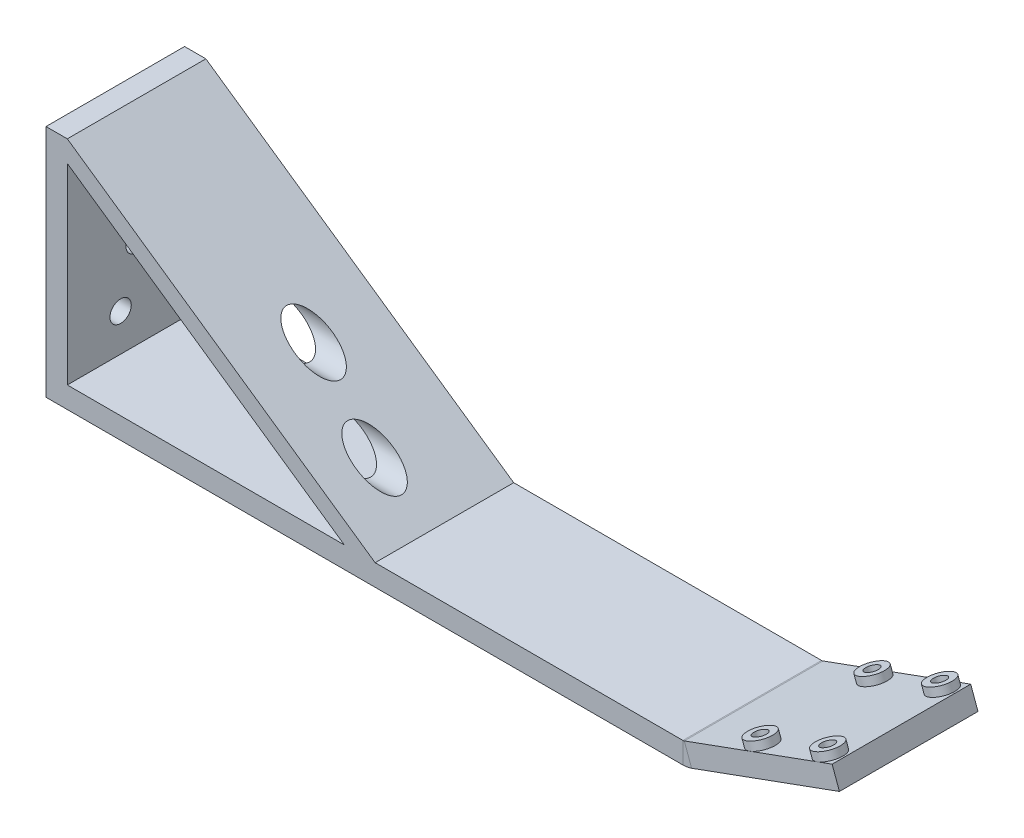
from build123d import *

# Parameters (mm, degrees)
ESQUISSE2_W                 = 150
ESQUISSE2_H                 = 26
T_LE_DE_BASE_PLI_E1_DEPTH   = 4
PLI_START                   = -13
PLI_ESQUISS_1_DEPTH         = 26
PLI_ESQUISS_1_2_DEPTH       = 26
ESQUISSE9_R                 = 2.5
ESQUISSE9_R_2               = 1.25
BOSS_EXTRU_1_DEPTH          = 1.5
ENL_V_START                 = -4
ENL_V_MAT_EXTRU_1_OUTLINE_R = 1.25
ENL_V_MAT_EXTRU_1_DEPTH     = 4
ESQUISSE11_W                = 4
ESQUISSE11_H                = 26
BOSS_EXTRU_2_DEPTH          = 40
BOSS_EXTRU_3_DEPTH          = 4
ESQUISSE12_R                = 2
ENL_V_MAT_EXTRU_5_DEPTH     = 151.86574353
ENL_V_MAT_EXTRU_6_REACH     = 152.866
ESQUISSE12_4_R              = 3.5
ESQUISSE12_4_R_2            = 2


# Read off the part's stored shape, not the designer's step: Pli esquissé1, Enlèv. mat.-Extru.1
# Sheet-metal steps are written as plain solids
with BuildPart() as part:
    # Esquisse2 → Tôle de base pliée1 (new body)
    with BuildSketch(Plane(origin=(0, 0, 0), x_dir=(1, 0, 0), z_dir=(0, 1, 0))):
        Rectangle(ESQUISSE2_W, ESQUISSE2_H)
    extrude(amount=-T_LE_DE_BASE_PLI_E1_DEPTH)

    # Pli esquissé1 outline → Pli esquissé1 (cut)
    with BuildSketch(Plane.XY.offset(PLI_START)):
        with BuildLine():
            Line((75, 0), (56.347473252, 0))
            Line((56.347473252, 0), (46.142385808, -3.714348068))
            ThreePointArc((46.142385808, -3.714348068), (45.344875155, -3.928040403), (44.522373197, -4))
            Line((44.522373197, -4), (75, -4))
            Line((75, -4), (75, 0))
        make_face()
    extrude(amount=PLI_ESQUISS_1_DEPTH, mode=Mode.SUBTRACT)

    # Pli esquiss_1 2 outline → Pli esquiss_1 2 (add)
    with BuildSketch(Plane.XY.offset(PLI_START)):
        with BuildLine():
            Line((56.347473252, 0), (73.884342049, 6.382898245))
            Line((73.884342049, 6.382898245), (72.516261476, 10.141668728))
            Line((72.516261476, 10.141668728), (44.774305234, 0.044422416))
            ThreePointArc((44.774305234, 0.044422416), (44.650282444, 0.011190609), (44.522373197, 0))
            Line((44.522373197, 0), (56.347473252, 0))
        make_face()
    extrude(amount=PLI_ESQUISS_1_2_DEPTH)

    # Esquisse9 → Boss.-Extru.1 (add)
    # profile 1 of 4: a face of its own
    with BuildSketch(Plane(origin=(5.223321668, -14.350958338, 0), x_dir=(0.9396926207859082, 0.34202014332566943, 0), z_dir=(-0.34202014332566943, 0.9396926207859082, 0))):
        with Locations(Location((55.111650787, 10.5, 0), (0, 0, 90))):
            Circle(ESQUISSE9_R)
        with Locations(Location((55.111650787, 10.5, 0), (0, 0, 180))):
            Circle(ESQUISSE9_R_2, mode=Mode.SUBTRACT)
    # profile 2 of 4: a face of its own
    with BuildSketch(Plane(origin=(5.223321668, -14.350958338, 0), x_dir=(0.9396926207859082, 0.34202014332566943, 0), z_dir=(-0.34202014332566943, 0.9396926207859082, 0))):
        with Locations(Location((68.611650787, 10.5, 0), (0, 0, 90))):
            Circle(ESQUISSE9_R)
        with Locations(Location((68.611650787, 10.5, 0), (0, 0, 180))):
            Circle(ESQUISSE9_R_2, mode=Mode.SUBTRACT)
    # profile 3 of 4: a face of its own
    with BuildSketch(Plane(origin=(5.223321668, -14.350958338, 0), x_dir=(0.9396926207859082, 0.34202014332566943, 0), z_dir=(-0.34202014332566943, 0.9396926207859082, 0))):
        with Locations((68.611650787, -10.5)):
            Circle(ESQUISSE9_R)
        with Locations((68.611650787, -10.5)):
            Circle(ESQUISSE9_R_2, mode=Mode.SUBTRACT)
    # profile 4 of 4: a face of its own
    with BuildSketch(Plane(origin=(5.223321668, -14.350958338, 0), x_dir=(0.9396926207859082, 0.34202014332566943, 0), z_dir=(-0.34202014332566943, 0.9396926207859082, 0))):
        with Locations((55.111650787, -10.5)):
            Circle(ESQUISSE9_R)
        with Locations((55.111650787, -10.5)):
            Circle(ESQUISSE9_R_2, mode=Mode.SUBTRACT)
    extrude(amount=BOSS_EXTRU_1_DEPTH)

    # Enlèv. mat.-Extru.1 outline → Enlèv. mat.-Extru.1 (cut)
    with BuildSketch(Plane(origin=(5.223321668, -14.350958338, 0), x_dir=(0.9396926207859082, 0.34202014332566943, 0), z_dir=(-0.34202014332566943, 0.9396926207859082, 0)).offset(ENL_V_START)):
        with Locations((68.611650787, 10.5)):
            Circle(ENL_V_MAT_EXTRU_1_OUTLINE_R)
        with Locations((68.611650787, -10.5)):
            Circle(ENL_V_MAT_EXTRU_1_OUTLINE_R)
        with Locations((55.111650787, 10.5)):
            Circle(ENL_V_MAT_EXTRU_1_OUTLINE_R)
        with Locations((55.111650787, -10.5)):
            Circle(ENL_V_MAT_EXTRU_1_OUTLINE_R)
    extrude(amount=ENL_V_MAT_EXTRU_1_DEPTH, mode=Mode.SUBTRACT)

    # Esquisse11 → Boss.-Extru.2 (add)
    with BuildSketch(Plane(origin=(0, 0, 0), x_dir=(1, 0, 0), z_dir=(0, 1, 0))):
        with Locations((-73, 0)):
            Rectangle(ESQUISSE11_W, ESQUISSE11_H)
    extrude(amount=BOSS_EXTRU_2_DEPTH)

    # Esquisse3D1 → Boss.-Extru.3 (add, along a direction that is not the sketch's normal)
    with BuildSketch(Plane(origin=(-71, 40, -13), x_dir=(0.7710162866859277, -0.533933827949873, 0.34705698816741753), z_dir=(0.5693204883585811, 0.8221156740600114, 0))):
        Polygon((0, 0), (9.023481692, -24.38394509), (74.915650416, 0), (65.892168724, 24.38394509), align=None)
    extrude(amount=-BOSS_EXTRU_3_DEPTH, dir=(0, 1, 0))

    # Esquisse12 → Enlèv. mat.-Extru.5 (cut, through all)
    with BuildSketch(Plane(origin=(-71, 0, 0), x_dir=(0, 0, -1), z_dir=(1, 0, 0))):
        with Locations((-3, 7)):
            Circle(ESQUISSE12_R)
        with Locations((0, 17)):
            Circle(ESQUISSE12_R)
    extrude(amount=-ENL_V_MAT_EXTRU_5_DEPTH, mode=Mode.SUBTRACT)

    # Enlèv. mat.-Extru.6: up to this plane
    enl_v_mat_extru_6_end = Plane(origin=(-4.291041229, -6.196390829, 0), z_dir=(0.5693204883585812, 0.8221156740600113, 0))
    # Esquisse12<4> → Enlèv. mat.-Extru.6 (cut, up to the surface)
    with BuildSketch(Plane(origin=(-71, 0, 0), x_dir=(0, 0, -1), z_dir=(1, 0, 0)), mode=Mode.PRIVATE) as enl_v_mat_extru_6_sk1:
        with Locations(Location((-3, 7, 0), (0, 0, 90))):
            Circle(ESQUISSE12_4_R)
        with Locations((-3, 7)):
            Circle(ESQUISSE12_4_R_2, mode=Mode.SUBTRACT)
    enl_v_mat_extru_6_tool1 = split(extrude(enl_v_mat_extru_6_sk1.sketch, amount=ENL_V_MAT_EXTRU_6_REACH, mode=Mode.PRIVATE), bisect_by=enl_v_mat_extru_6_end, keep=Keep.BOTH, mode=Mode.PRIVATE)
    add(enl_v_mat_extru_6_tool1.solids().sort_by_distance((-71, 3.598995, 3))[0], mode=Mode.SUBTRACT)
    # Esquisse12<4> → Enlèv. mat.-Extru.6 (cut, up to the surface)
    with BuildSketch(Plane(origin=(-71, 0, 0), x_dir=(0, 0, -1), z_dir=(1, 0, 0)), mode=Mode.PRIVATE) as enl_v_mat_extru_6_sk2:
        with Locations((-3, 7)):
            Circle(ESQUISSE12_4_R_2)
    enl_v_mat_extru_6_tool2 = split(extrude(enl_v_mat_extru_6_sk2.sketch, amount=ENL_V_MAT_EXTRU_6_REACH, mode=Mode.PRIVATE), bisect_by=enl_v_mat_extru_6_end, keep=Keep.BOTH, mode=Mode.PRIVATE)
    add(enl_v_mat_extru_6_tool2.solids().sort_by_distance((-71, 7, 3))[0], mode=Mode.SUBTRACT)
    # Esquisse12<4> → Enlèv. mat.-Extru.6 (cut, up to the surface)
    with BuildSketch(Plane(origin=(-71, 0, 0), x_dir=(0, 0, -1), z_dir=(1, 0, 0)), mode=Mode.PRIVATE) as enl_v_mat_extru_6_sk3:
        with Locations(Location((0, 17, 0), (0, 0, 90))):
            Circle(ESQUISSE12_4_R)
        with Locations((0, 17)):
            Circle(ESQUISSE12_4_R_2, mode=Mode.SUBTRACT)
    enl_v_mat_extru_6_tool3 = split(extrude(enl_v_mat_extru_6_sk3.sketch, amount=ENL_V_MAT_EXTRU_6_REACH, mode=Mode.PRIVATE), bisect_by=enl_v_mat_extru_6_end, keep=Keep.BOTH, mode=Mode.PRIVATE)
    add(enl_v_mat_extru_6_tool3.solids().sort_by_distance((-71, 13.598995, 0))[0], mode=Mode.SUBTRACT)
    # Esquisse12<4> → Enlèv. mat.-Extru.6 (cut, up to the surface)
    with BuildSketch(Plane(origin=(-71, 0, 0), x_dir=(0, 0, -1), z_dir=(1, 0, 0)), mode=Mode.PRIVATE) as enl_v_mat_extru_6_sk4:
        with Locations((0, 17)):
            Circle(ESQUISSE12_4_R_2)
    enl_v_mat_extru_6_tool4 = split(extrude(enl_v_mat_extru_6_sk4.sketch, amount=ENL_V_MAT_EXTRU_6_REACH, mode=Mode.PRIVATE), bisect_by=enl_v_mat_extru_6_end, keep=Keep.BOTH, mode=Mode.PRIVATE)
    add(enl_v_mat_extru_6_tool4.solids().sort_by_distance((-71, 17, 0))[0], mode=Mode.SUBTRACT)


solid = part.part
